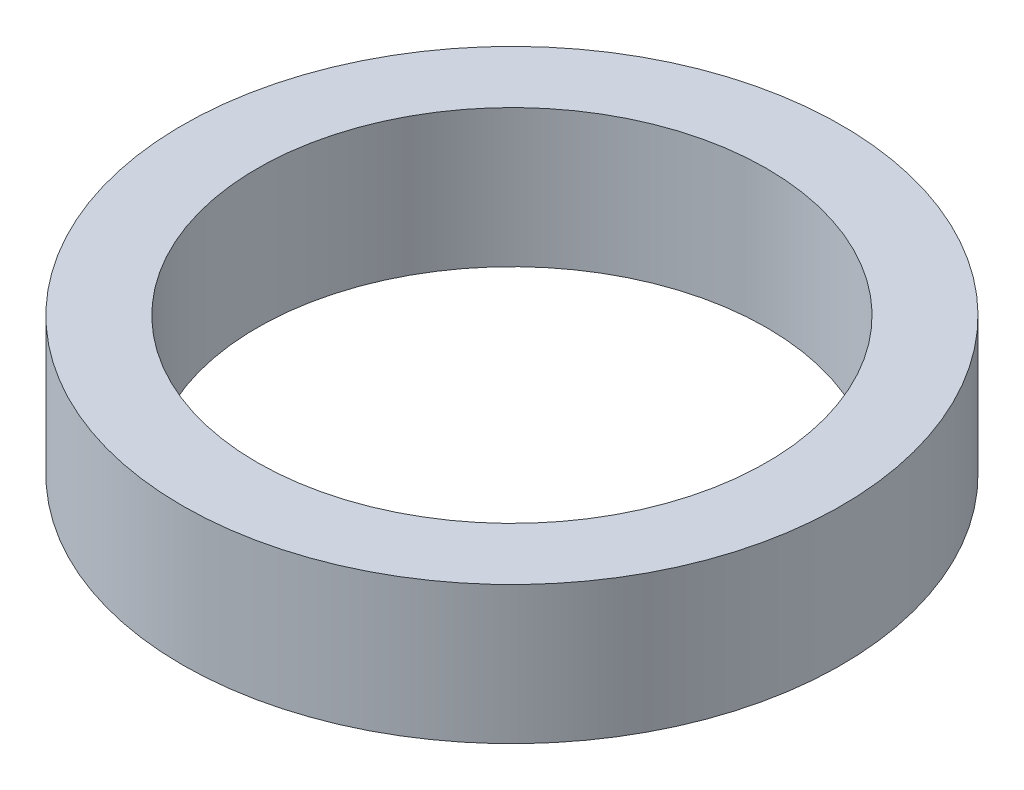
from build123d import *

# Parameters (mm, degrees)
SKETCH1_R           = 55
BOSS_EXTRUDE1_DEPTH = 23
SKETCH2_R           = 42.5
CUT_EXTRUDE1_DEPTH  = 82.111035008


with BuildPart() as part:
    # Sketch1 → Boss-Extrude1 (new body)
    with BuildSketch(Plane(origin=(0, 0, 0), x_dir=(1, 0, 0), z_dir=(0, 1, 0))):
        Circle(SKETCH1_R)
    extrude(amount=BOSS_EXTRUDE1_DEPTH)

    # Sketch2 → Cut-Extrude1 (cut, through all)
    with BuildSketch(Plane(origin=(0, 0, 0), x_dir=(1, 0, 0), z_dir=(0, 1, 0))):
        Circle(SKETCH2_R)
    extrude(amount=CUT_EXTRUDE1_DEPTH, mode=Mode.SUBTRACT)


solid = part.part
